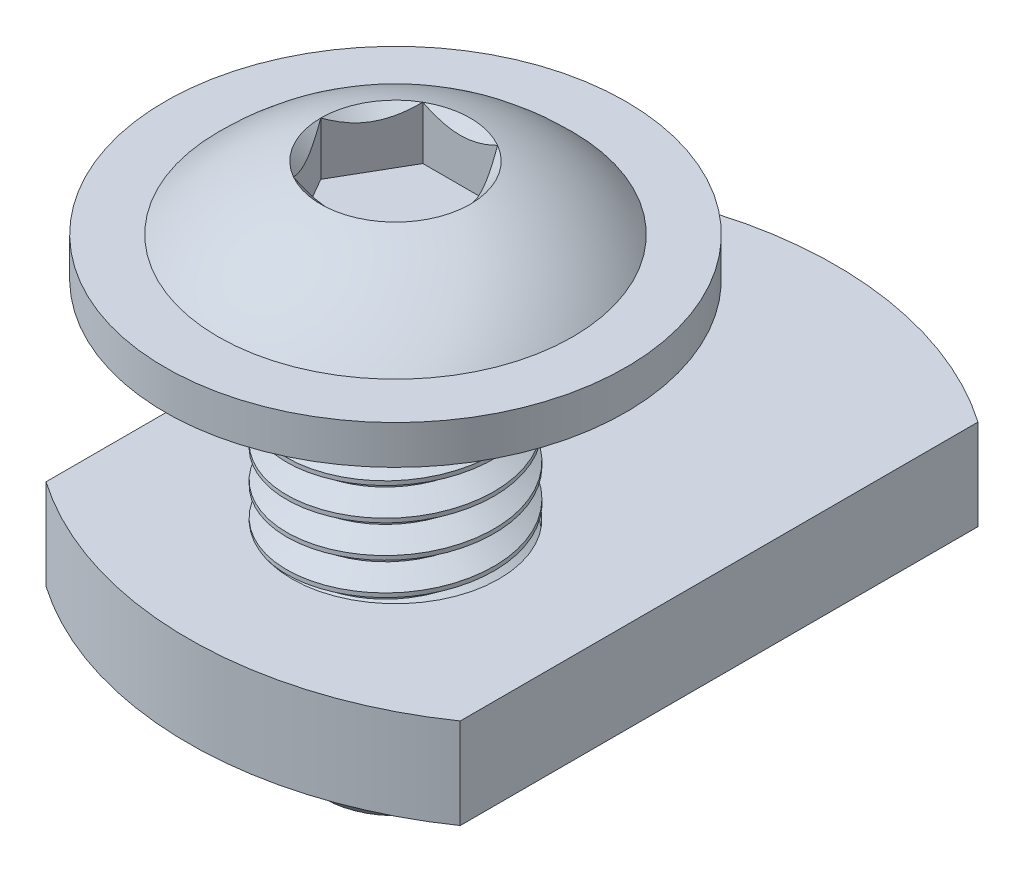
from build123d import *

# Parameters (mm, degrees)
SKETCH2_W                    = 4
SKETCH2_H                    = 16
CHAMFER1_SIZE                = 1.25
CUT_SWEEP1_PITCH             = 1.25
SKETCH20_R                   = 8.9
BOSS_EXTRUDE1_DEPTH          = 1.5
CUT_EXTRUDE1_DEPTH           = 2.5
SKETCH7_R                    = 2.886751346
CUT_EXTRUDE2_DEPTH           = 2.052763
CUT_EXTRUDE2_TAPER           = 45
CUT_EXTRUDE2_OTHER_WAY_DEPTH = 24.590946768
SKETCH10_R                   = 4
EXTRUDE2_DEPTH               = 2.5
SKETCH11_R                   = 4.5
CUT_EXTRUDE4_DEPTH           = 1.5


with BuildPart() as part:
    # Sketch2 → Revolve2 (revolve)
    with BuildSketch(Plane.XY, mode=Mode.PRIVATE) as revolve2_sk:
        with Locations((-2, 8)):
            Rectangle(SKETCH2_W, SKETCH2_H)
    revolve(revolve2_sk.sketch.rotate(Axis((0, 0, 0), (0, 1, 0)), 270), axis=Axis((0, 0, 0), (0, 1, 0)))

    # Chamfer1
    chamfer1_edges = [part.edges().sort_by_distance(p)[0] for p in [
        (0, 0, 4),
    ]]
    chamfer(chamfer1_edges, length=CHAMFER1_SIZE)

    # Cut-Sweep1: arcs per turn and ends read off the stored shape
    # Cut-Sweep1: the profile of Sketch4 profile screwed along a right-hand helix through 14 turns, 6 arcs to a turn; built about Z, then put on its axis
    cut_sweep1_z = Axis((0, 0, 0), (0, 0, 1))
    cut_sweep1_corners = [(4.0003, 0, -2.343923205), (4.0003, 0, -1.249826795), (3.188101184, 0, -1.71875), (3.188101184, 0, -1.875)]
    with BuildLine(mode=Mode.PRIVATE) as cut_sweep1_profile:
        Line(cut_sweep1_corners[0], cut_sweep1_corners[1])
        Line(cut_sweep1_corners[1], cut_sweep1_corners[2])
        Line(cut_sweep1_corners[2], cut_sweep1_corners[3])
        Line(cut_sweep1_corners[3], cut_sweep1_corners[0])
    cut_sweep1_cap = Face(cut_sweep1_profile.wire())
    cut_sweep1_turn_angles = [0, 30, 60, 90, 120, 150, 180, 210, 240, 270, 300, 330, 360]
    cut_sweep1_turn_weights = [1, 0.8660254037844387, 1, 0.8660254037844387, 1, 0.8660254037844387, 1, 0.8660254037844387, 1, 0.8660254037844387, 1, 0.8660254037844387, 1]
    cut_sweep1_turn_rails = [Edge.make_bspline([Vector(p[0], p[1], 0).rotate(cut_sweep1_z, cut_sweep1_turn_angles[k]) / cut_sweep1_turn_weights[k] + Vector(0, 0, p[2] + CUT_SWEEP1_PITCH * cut_sweep1_turn_angles[k] / 360) for k in range(13)], [0, 0, 0, 1, 1, 2, 2, 3, 3, 4, 4, 5, 5, 6, 6, 6], 2, cut_sweep1_turn_weights) for p in cut_sweep1_corners]
    cut_sweep1_turn_sides = [Face.make_surface_from_curves(cut_sweep1_turn_rails[p[0]], cut_sweep1_turn_rails[p[1]]) for p in [(0, 1), (1, 2), (2, 3), (3, 0)]]
    cut_sweep1 = Plane(origin=(0, 16, 0), x_dir=(1, 0, 0), z_dir=(0, -1, 0)) * Solid(Shell([*[p.moved(Location((0, 0, CUT_SWEEP1_PITCH * i))) for i in range(14) for p in cut_sweep1_turn_sides], cut_sweep1_cap, cut_sweep1_cap.rotate(cut_sweep1_z, 5040).moved(Location((0, 0, CUT_SWEEP1_PITCH * 5040 / 360)))]))
    add(cut_sweep1, mode=Mode.SUBTRACT)

    # Sketch5 → Revolve3 (revolve)
    with BuildSketch(Plane.XY):
        with BuildLine():
            Line((0, 16), (0, 20.4))
            ThreePointArc((0, 20.4), (-3.719290927, 19.645135466), (-6.85, 17.5))
            Line((-6.85, 17.5), (-6.85, 16))
            Line((-6.85, 16), (0, 16))
        make_face()
    revolve(axis=Axis((0, 0, 0), (0, 1, 0)))

    # Sketch20 → Boss-Extrude1 (add)
    with BuildSketch(Plane.XZ.offset(-16)):
        with Locations(Location((0, 0, 0), (0, 0, 270))):
            Circle(SKETCH20_R)
    extrude(amount=-BOSS_EXTRUDE1_DEPTH)

    # Sketch6 → Cut-Extrude1 (cut)
    with BuildSketch(Plane(origin=(0, 20.4, 0), x_dir=(-1, 0, 0), z_dir=(0, 1, 0))):
        Polygon((1.443375673, 2.5), (-1.443375673, 2.5), (-2.886751346, 0), (-1.443375673, -2.5), (1.443375673, -2.5), (2.886751346, 0), align=None)
    extrude(amount=-CUT_EXTRUDE1_DEPTH, mode=Mode.SUBTRACT)

    # Sketch7 → Cut-Extrude2 (cut)
    with BuildSketch(Plane(origin=(0, 19.952763264, 0), x_dir=(-1, 0, 0), z_dir=(0, 1, 0))):
        Circle(SKETCH7_R)
    extrude(amount=-CUT_EXTRUDE2_DEPTH, taper=CUT_EXTRUDE2_TAPER, mode=Mode.SUBTRACT)

    # Sketch7 → Cut-Extrude2 other way (cut)
    with BuildSketch(Plane(origin=(0, 19.952763264, 0), x_dir=(-1, 0, 0), z_dir=(0, 1, 0))):
        Circle(SKETCH7_R)
    extrude(amount=CUT_EXTRUDE2_OTHER_WAY_DEPTH, mode=Mode.SUBTRACT)


with BuildPart() as body_2:
    # Sketch10 → Extrude2 (new, symmetric)
    with BuildSketch(Plane.XZ.offset(-5.475)):
        with BuildLine():
            Line((-8, -14.5), (-8, 5.5))
            ThreePointArc((-8, 5.5), (0, 8), (8, 5.5))
            Line((8, 5.5), (8, -14.5))
            ThreePointArc((8, -14.5), (0, -17), (-8, -14.5))
        make_face()
        with Locations(Location((0, 0, 0), (0, 0, 270))):
            Circle(SKETCH10_R, mode=Mode.SUBTRACT)
    extrude(amount=EXTRUDE2_DEPTH, both=True)

    # Sketch11 → Cut-Extrude4 (cut)
    with BuildSketch(Plane.XZ.offset(-2.975)):
        with BuildLine():
            Line((8, -14.5), (8, 5.5))
            ThreePointArc((8, 5.5), (0, 8), (-8, 5.5))
            Line((-8, 5.5), (-8, -14.5))
            ThreePointArc((-8, -14.5), (0, -17), (8, -14.5))
        make_face()
        with Locations(Location((0, 0, 0), (0, 0, 270))):
            Circle(SKETCH11_R, mode=Mode.SUBTRACT)
    extrude(amount=-CUT_EXTRUDE4_DEPTH, mode=Mode.SUBTRACT)


solid = Compound([part.part, body_2.part])
